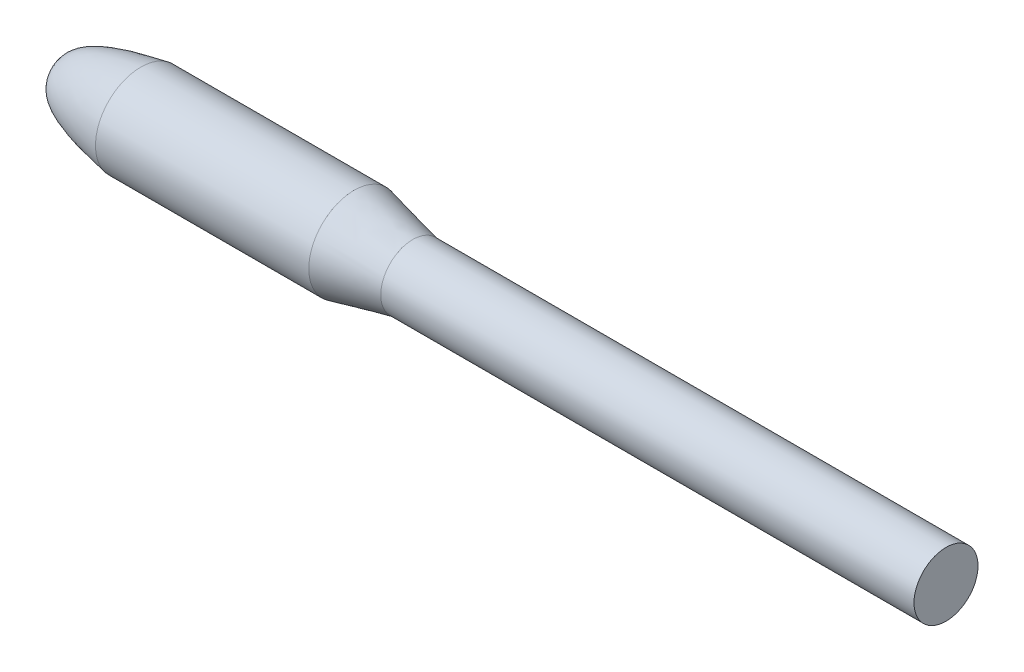
from build123d import *

# Parameters (mm, degrees)
SKETCH2_R           = 85
BOSS_EXTRUDE1_DEPTH = 400
SKETCH4_R           = 60
BOSS_EXTRUDE2_DEPTH = 1000


with BuildPart() as part:
    # Sketch1 → Revolve1 (revolve)
    with BuildSketch(Plane.XY):
        with BuildLine():
            Line((150, 85), (150, 0))
            Line((150, 0), (0, 0))
            add(Edge.make_bspline(
                [(0, 0), (-0.012294225, 3.891554312), (-0.027437579, 8.684958126), (0.361573767, 14.085722357), (0.576098453, 16.090496183), (0.782493435, 17.604822189), (0.986227589, 18.854298664), (1.188670863, 19.931536976), (1.390404268, 20.885679324), (1.591698837, 21.746529091), (1.792703864, 22.533746067), (1.993507167, 23.261083862), (2.253808552, 24.139979457), (2.580573656, 25.146175179), (2.983585386, 26.259501153), (3.385879093, 27.271261727), (3.787683439, 28.201566994), (4.189138614, 29.064817448), (4.590335615, 29.871726974), (5.05331092, 30.74778076), (5.583218589, 31.683457084), (6.185429632, 32.669732492), (6.787226927, 33.590624245), (7.451481511, 34.546094958), (8.182770444, 35.530963646), (8.985083876, 36.540013411), (9.850344603, 37.562485558), (10.782608842, 38.595746542), (11.785011743, 39.636928062), (12.851029789, 40.680352273), (13.983960321, 41.72463117), (15.186170623, 42.768194245), (16.387975322, 43.755294725), (17.654380903, 44.743506811), (18.987602276, 45.731471932), (20.389198856, 46.717890971), (21.790522044, 47.657861765), (23.257103599, 48.59836715), (24.790441056, 49.538186318), (26.391587757, 50.476245251), (28.05829275, 51.412163763), (29.791720393, 52.345056651), (31.59268286, 53.274185034), (33.459445798, 54.199628429), (35.392909821, 55.120726442), (37.459746918, 56.067201212), (39.59327023, 57.006562681), (41.860151348, 57.96659169), (44.193707143, 58.917521836), (46.660609333, 59.885320784), (49.260404933, 60.867669295), (51.99403381, 61.861671206), (54.860992187, 62.865616104), (57.794602823, 63.85555089), (60.861539281, 64.853573463), (64.06149587, 65.858380358), (67.461497598, 66.888166734), (70.995135905, 67.920234745), (74.662088876, 68.953918346), (78.462130407, 69.988575944), (82.462197069, 71.040436012), (86.662284614, 72.107100186), (91.062388571, 73.18640193), (95.662505252, 74.276388609), (100.462631288, 75.375305679), (105.462763855, 76.481579791), (110.662900527, 77.593803027), (116.063039296, 78.710717608), (121.663178505, 79.831201671), (127.529872228, 80.967142806), (133.663251007, 82.116215238), (140.063409966, 83.276352633), (145.198462089, 84.177415336), (148.333178957, 84.715838785), (149.39998937, 84.897876633), (149.733326587, 84.954653305), (149.933332963, 84.98866355), (150, 85)],
                knots=[0, 0, 0, 0, 0.061462209, 0.075705788, 0.085548437, 0.093321935, 0.099856333, 0.105553797, 0.110642995, 0.115267654, 0.119524592, 0.123482434, 0.127191759, 0.134010181, 0.140199136, 0.145901384, 0.151215493, 0.156212588, 0.160945789, 0.165455878, 0.171870938, 0.177937368, 0.183716425, 0.189254732, 0.196326298, 0.203099892, 0.209625632, 0.217492532, 0.225090541, 0.232464167, 0.24106462, 0.249438142, 0.257620809, 0.265641058, 0.274822876, 0.28384341, 0.292725747, 0.301488561, 0.311376345, 0.321146599, 0.330814589, 0.341584449, 0.352255608, 0.362840299, 0.374512001, 0.386101174, 0.398765505, 0.411352526, 0.425006218, 0.438588433, 0.453231339, 0.468927603, 0.484557057, 0.501237456, 0.517857889, 0.535527769, 0.554243231, 0.574001115, 0.593705628, 0.614453399, 0.636242373, 0.65907093, 0.682937829, 0.707842151, 0.733783254, 0.760760729, 0.78877436, 0.81782409, 0.847909993, 0.879032247, 0.912262482, 0.946527454, 0.981827786, 0.994656092, 0.99679374, 0.998931275, 1, 1, 1, 1], degree=3))
        make_face()
    revolve(axis=Axis((0, 0, 0), (-1, 0, 0)))

    # Sketch2 → Boss-Extrude1 (add)
    with BuildSketch(Plane(origin=(150, 0, 0), x_dir=(0, 0, -1), z_dir=(1, 0, 0))):
        Circle(SKETCH2_R)
    extrude(amount=BOSS_EXTRUDE1_DEPTH)

    # Loft1: read off the stored shape, not the designer's step
    # Loft1: loft between two sections, ruled curve by curve
    loft1_from = [
        Edge.make_bspline([(660, 21.137943081, 56.153248902), (660, 133.444440886, 13.877362739), (660, 91.168554723, -98.429135065), (660, -21.137943081, -56.153248902), (660, -133.444440886, -13.877362739), (660, -91.168554723, 98.429135065), (660, 21.137943081, 56.153248902)], [0, 0, 0, 0, 0.5, 0.5, 0.5, 1, 1, 1, 1], 3, [1, 0.333333333, 0.333333333, 1, 0.333333333, 0.333333333, 1]),
    ]
    loft1_to = [
        Edge.make_bspline([(550, 45.635427758, 71.710583133), (550, 189.056594025, -19.560272383), (550, 97.785738508, -162.98143865), (550, -45.635427758, -71.710583133), (550, -189.056594025, 19.560272383), (550, -97.785738508, 162.98143865), (550, 45.635427758, 71.710583133)], [0, 0, 0, 0, 0.5, 0.5, 0.5, 1, 1, 1, 1], 3, [1, 0.333333333, 0.333333333, 1, 0.333333333, 0.333333333, 1]),
    ]
    loft1 = Solid(Shell([*[Face.make_surface_from_curves(loft1_from[k], loft1_to[k]) for k in range(1)], Face(Wire(loft1_from)), Face(Wire(loft1_to))]))
    add(loft1)

    # Sketch4 → Boss-Extrude2 (add)
    with BuildSketch(Plane(origin=(660, 0, 0), x_dir=(0, 0, -1), z_dir=(1, 0, 0))):
        with Locations(Location((0, 0, 0), (0, 0, 159.372))):
            Circle(SKETCH4_R)
    extrude(amount=BOSS_EXTRUDE2_DEPTH)


solid = part.part
